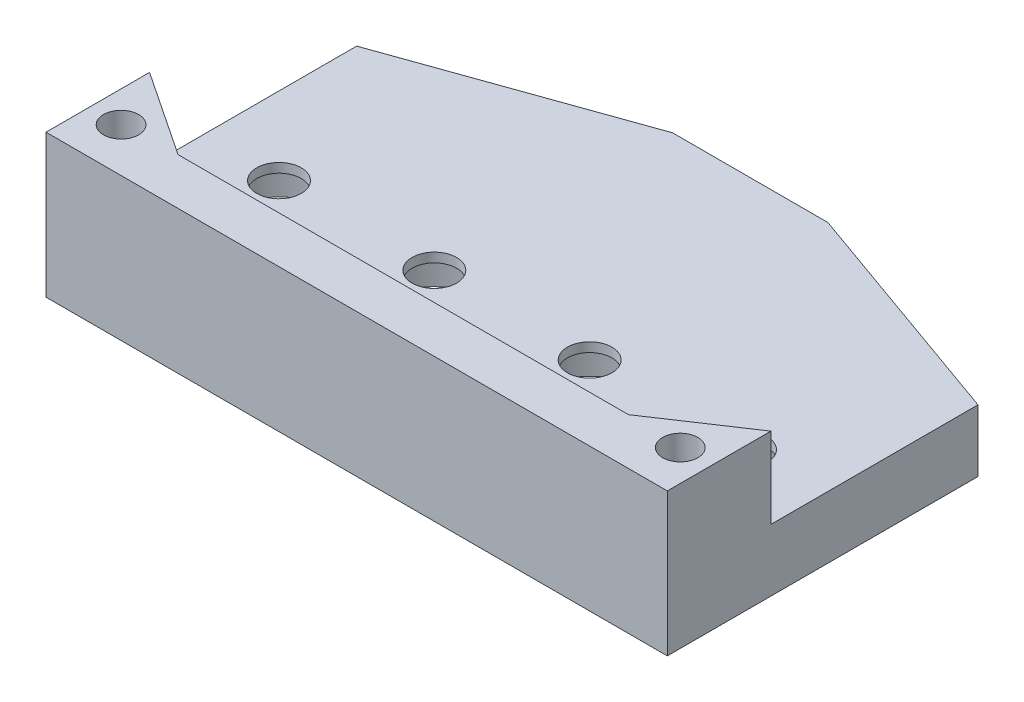
from build123d import *

# Parameters (mm, degrees)
SKETCH2_R           = 2.15
BOSS_EXTRUDE1_DEPTH = 6
BOSS_EXTRUDE2_DEPTH = 7.8
SKETCH4_R           = 1.7
CUT_EXTRUDE1_DEPTH  = 73.349429853
SKETCH5_R           = 6.55
CUT_EXTRUDE2_DEPTH  = 5.1


with BuildPart() as part:
    # Sketch2 → Boss-Extrude1 (new body)
    with BuildSketch(Plane(origin=(0, 0, 0), x_dir=(1, 0, 0), z_dir=(0, 1, 0))):
        Polygon((0, 0), (0, 30), (22.5, 38), (37.5, 38), (60, 30), (60, 0), align=None)
        with Locations((7.5, 15)):
            Circle(SKETCH2_R, mode=Mode.SUBTRACT)
        with Locations((22.5, 15)):
            Circle(SKETCH2_R, mode=Mode.SUBTRACT)
        with Locations((37.5, 15)):
            Circle(SKETCH2_R, mode=Mode.SUBTRACT)
        with Locations((52.5, 15)):
            Circle(SKETCH2_R, mode=Mode.SUBTRACT)
    extrude(amount=BOSS_EXTRUDE1_DEPTH)

    # Sketch3 → Boss-Extrude2 (add)
    with BuildSketch(Plane(origin=(0, 6, 0), x_dir=(1, 0, 0), z_dir=(0, 1, 0))):
        Polygon((0, 10), (0, 0), (60, 0), (60, 10), (51.75, 4.5), (8.25, 4.5), align=None)
    extrude(amount=BOSS_EXTRUDE2_DEPTH)

    # Sketch4 → Cut-Extrude1 (cut, through all)
    with BuildSketch(Plane(origin=(0, 13.8, 0), x_dir=(1, 0, 0), z_dir=(0, 1, 0))):
        with Locations((3, 4.25)):
            Circle(SKETCH4_R)
        with Locations((57, 4.25)):
            Circle(SKETCH4_R)
    extrude(amount=-CUT_EXTRUDE1_DEPTH, mode=Mode.SUBTRACT)

    # Sketch5 → Cut-Extrude2 (cut)
    with BuildSketch(Plane(origin=(0, 0, 0), x_dir=(1, 0, 0), z_dir=(0, 1, 0))):
        with Locations((7.5, 15)):
            Circle(SKETCH5_R)
        with Locations((22.5, 15)):
            Circle(SKETCH5_R)
        with Locations((37.5, 15)):
            Circle(SKETCH5_R)
        with Locations((52.5, 15)):
            Circle(SKETCH5_R)
    extrude(amount=CUT_EXTRUDE2_DEPTH, mode=Mode.SUBTRACT)


solid = part.part
